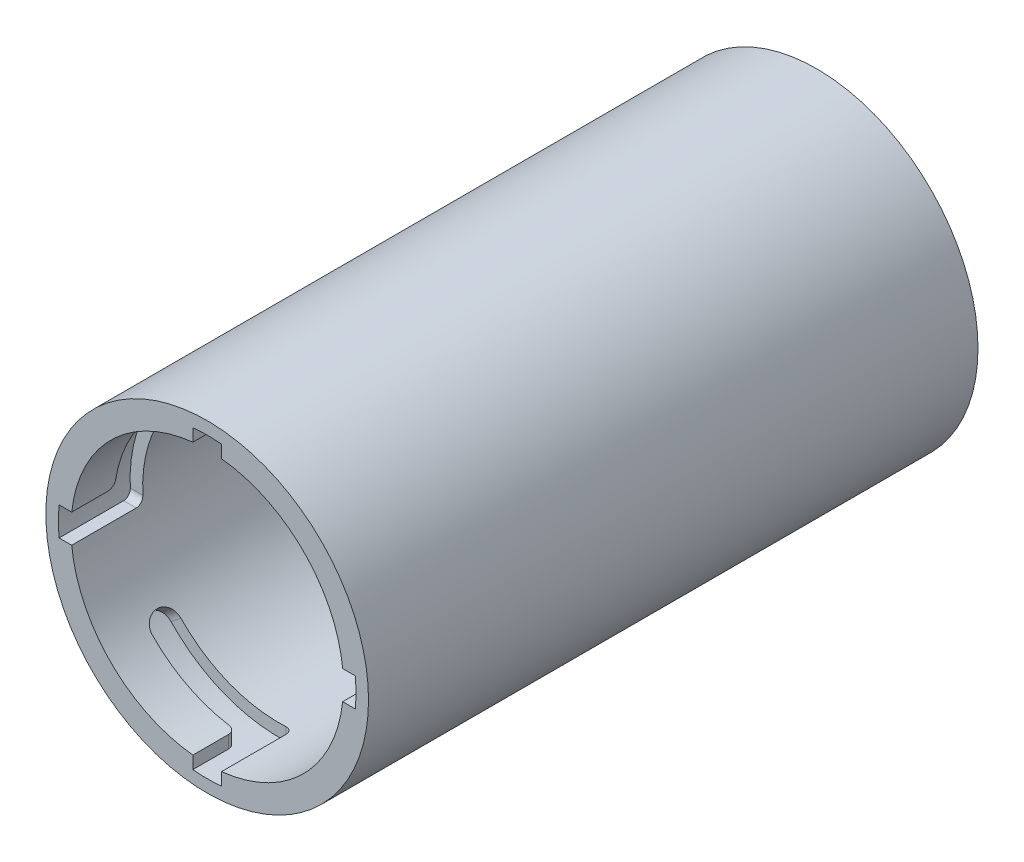
from build123d import *
from OCP.BRepFilletAPI import BRepFilletAPI_MakeFillet

# Parameters (mm, degrees)
SKETCH1_R                  = 22.5
SKETCH1_R_2                = 19
BOSS_EXTRUDE2_DEPTH        = 85
BOSS_EXTRUDE5_START        = -3
SKETCH3_R                  = 19
SKETCH3_R_2                = 6
BOSS_EXTRUDE5_DEPTH        = 3
CUT_EXTRUDE1_DEPTH         = 10
CUT_REVOLVE2_ANGLE         = 52.00000000000012
FILLET2_R                  = 2
FILLET2_R_2                = 1
CIRPATTERN1_COUNT          = 4
FILLET2_OF_CIRPATTERN1_R   = 2
FILLET2_OF_CIRPATTERN1_R_2 = 1
SKETCH17_R                 = 1.7499999999999998
CUT_EXTRUDE2_DEPTH         = 10


with BuildPart() as part:
    # Sketch1 → Boss-Extrude2 (new body)
    with BuildSketch(Plane.XY):
        Circle(SKETCH1_R)
        Circle(SKETCH1_R_2, mode=Mode.SUBTRACT)
    extrude(amount=-BOSS_EXTRUDE2_DEPTH)

    # Sketch3 → Boss-Extrude5 (add)
    with BuildSketch(Plane(origin=(0, 0, -85), x_dir=(-1, 0, 0), z_dir=(0, 0, -1)).offset(BOSS_EXTRUDE5_START)):
        with Locations(Location((0, 0, 0), (0, 0, 180))):
            Circle(SKETCH3_R)
        Circle(SKETCH3_R_2, mode=Mode.SUBTRACT)
    extrude(amount=BOSS_EXTRUDE5_DEPTH)

    # Sketch4 → Cut-Extrude1 (cut)
    with BuildSketch(Plane.XY):
        with BuildLine():
            ThreePointArc((1.999999999999999, 20.653389552322885), (1.27e-15, 20.75), (-2.000000000000001, 20.65338955232288))
            Line((-2, 20.65338955232288), (-2, 18.894443627691185))
            ThreePointArc((-2.000000000000001, 18.894443627691185), (1.16e-15, 19), (1.999999999999999, 18.894443627691185))
            Line((2, 18.894443627691185), (2, 20.65338955232288))
        make_face()
    cut_extrude1 = extrude(amount=-CUT_EXTRUDE1_DEPTH, mode=Mode.SUBTRACT)

    # Sketch8 → Cut-Revolve2 (revolve, cut)
    with BuildSketch(Plane(origin=(0, 0, 0), x_dir=(0, 0, -1), z_dir=(1, 0, 0))):
        Polygon((6.000000000000001, 20.75), (10, 20.75), (10, 18.9), (6.000000000000002, 18.9), align=None)
    cut_revolve2 = revolve(axis=Axis((0, 0, 0), (0, 0, -1)), revolution_arc=CUT_REVOLVE2_ANGLE, mode=Mode.SUBTRACT)

    # Fillet2
    fillet2_edges_1 = [part.edges().sort_by_distance(p)[0] for p in [
        (15.661713727933623, 12.236271822097425, -6.000000000000001),
        (15.661713727933623, 12.236271822097425, -10),
    ]]
    fillet2_edges_2 = [part.edges().sort_by_distance(p)[0] for p in [
        (-2, 19.773916590007033, -10),
        (2, 19.773916590007033, -6.000000000000002),
    ]]
    fillet2 = BRepFilletAPI_MakeFillet(part.part.solid().wrapped)
    for e in fillet2_edges_1:
        fillet2.Add(FILLET2_R - 0.0001, e.wrapped)
    for e in fillet2_edges_2:
        fillet2.Add(FILLET2_R_2 - 0.0001, e.wrapped)
    add(Compound.cast(fillet2.Shape()), mode=Mode.REPLACE)  # a hair under: the kernel refuses the full size

    # CirPattern1: Cut-Extrude1, Cut-Revolve2 ×4 about axis
    cirpattern1_axis = Axis((0, 0, 0), (0, 0, 1))
    add([cut_extrude1.rotate(cirpattern1_axis, i * 360 / CIRPATTERN1_COUNT) for i in range(1, CIRPATTERN1_COUNT)], mode=Mode.SUBTRACT)
    add([cut_revolve2.rotate(cirpattern1_axis, i * 360 / CIRPATTERN1_COUNT) for i in range(1, CIRPATTERN1_COUNT)], mode=Mode.SUBTRACT)

    # Fillet2 of CirPattern1
    fillet2_of_cirpattern1_edges_1 = [part.edges().sort_by_distance(p)[0] for p in [
        (-12.236271822097423, 15.661713727933625, -6.000000000000001),
        (-12.236271822097423, 15.661713727933627, -10),
        (-15.661713727933625, -12.236271822097423, -6.000000000000001),
        (-15.661713727933627, -12.236271822097423, -10),
        (12.236271822097422, -15.661713727933629, -6.000000000000001),
        (12.236271822097422, -15.661713727933627, -10),
    ]]
    fillet2_of_cirpattern1_edges_2 = [part.edges().sort_by_distance(p)[0] for p in [
        (-19.773916590007033, -1.9999999999999978, -10),
        (-19.773916590007033, 2.000000000000002, -6.000000000000002),
        (1.9999999999999976, -19.773916590007033, -10),
        (-2.000000000000002, -19.773916590007033, -6.000000000000002),
        (19.773916590007033, 1.9999999999999956, -10),
        (19.773916590007033, -2.000000000000004, -6.000000000000002),
    ]]
    fillet2_of_cirpattern1 = BRepFilletAPI_MakeFillet(part.part.solid().wrapped)
    for e in fillet2_of_cirpattern1_edges_1:
        fillet2_of_cirpattern1.Add(FILLET2_OF_CIRPATTERN1_R - 0.0001, e.wrapped)
    for e in fillet2_of_cirpattern1_edges_2:
        fillet2_of_cirpattern1.Add(FILLET2_OF_CIRPATTERN1_R_2 - 0.0001, e.wrapped)
    add(Compound.cast(fillet2_of_cirpattern1.Shape()), mode=Mode.REPLACE)  # a hair under: the kernel refuses the full size

    # Sketch17 → Cut-Extrude2 (cut)
    with BuildSketch(Plane(origin=(0, 0, -85), x_dir=(-1, 0, 0), z_dir=(0, 0, -1))):
        with Locations((-4, 14.16)):
            Circle(SKETCH17_R)
        with Locations((4, 14.16)):
            Circle(SKETCH17_R)
    extrude(amount=-CUT_EXTRUDE2_DEPTH, mode=Mode.SUBTRACT)


solid = part.part
